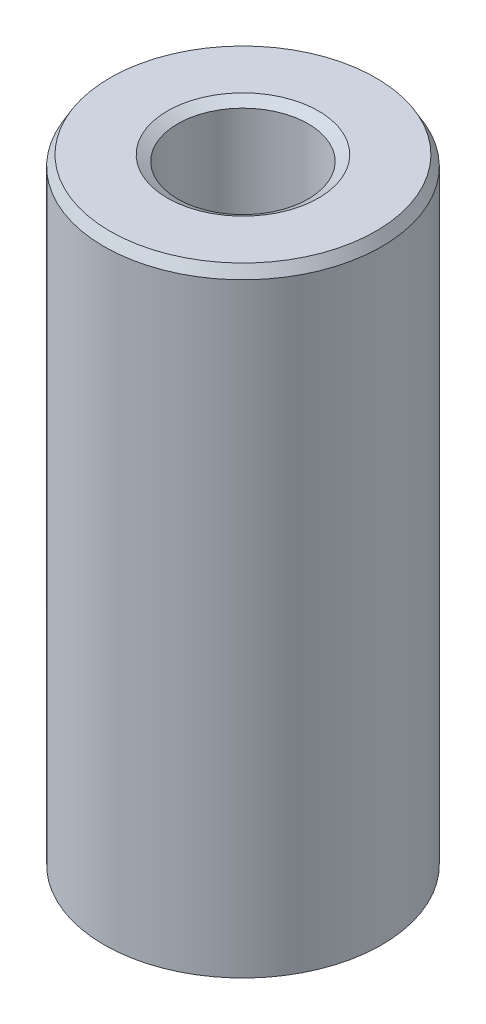
from build123d import *
from OCP.BRepFilletAPI import BRepFilletAPI_MakeChamfer

# Parameters (mm, degrees)
SKETCH1_R           = 22.5
BOSS_EXTRUDE1_DEPTH = 100.612969932
SKETCH2_R           = 10.570219686
CUT_EXTRUDE1_DEPTH  = 106.524735103
CHAMFER1_SIZE       = 1.670223606
CHAMFER1_SIZE2      = 0.964304048


with BuildPart() as part:
    # Sketch1 → Boss-Extrude1 (new body)
    with BuildSketch(Plane(origin=(0, 0, 0), x_dir=(1, 0, 0), z_dir=(0, 1, 0))):
        Circle(SKETCH1_R)
    extrude(amount=BOSS_EXTRUDE1_DEPTH)

    # Sketch2 → Cut-Extrude1 (cut, through all)
    with BuildSketch(Plane(origin=(0, 0, 0), x_dir=(1, 0, 0), z_dir=(0, 1, 0))):
        Circle(SKETCH2_R)
    extrude(amount=CUT_EXTRUDE1_DEPTH, mode=Mode.SUBTRACT)

    # Chamfer1: one chamfer whose edges measure the first distance from different faces: ONE call of the kernel's chamfer builder (chamfer() names one face for all edges)
    chamfer1_edges_1 = [part.edges().sort_by_distance(p)[0] for p in [
        (-10.570219686, 100.612969932, 0),
    ]]
    chamfer1_side_1 = [part.faces().sort_by_distance(p)[0] for p in [
        (-21.863603897, 100.612969932, 0),
    ]]
    chamfer1_edges_2 = [part.edges().sort_by_distance(p)[0] for p in [
        (-10.570219686, 0, 0),
    ]]
    chamfer1_side_2 = [part.faces().sort_by_distance(p)[0] for p in [
        (-10.570219686, 50.306484966, 0),
    ]]
    chamfer1_edges_3 = [part.edges().sort_by_distance(p)[0] for p in [
        (-22.5, 0, 0),
    ]]
    chamfer1_side_3 = [part.faces().sort_by_distance(p)[0] for p in [
        (-21.863603897, 0, 0),
    ]]
    chamfer1_edges_4 = [part.edges().sort_by_distance(p)[0] for p in [
        (-22.5, 100.612969932, 0),
    ]]
    chamfer1_side_4 = [part.faces().sort_by_distance(p)[0] for p in [
        (-22.5, 50.306484966, 0),
    ]]
    chamfer1 = BRepFilletAPI_MakeChamfer(part.part.solid().wrapped)
    for e in chamfer1_edges_1:
        chamfer1.Add(CHAMFER1_SIZE, CHAMFER1_SIZE2, e.wrapped, chamfer1_side_1[0].wrapped)  # the first distance lies on this face
    for e in chamfer1_edges_2:
        chamfer1.Add(CHAMFER1_SIZE, CHAMFER1_SIZE2, e.wrapped, chamfer1_side_2[0].wrapped)  # the first distance lies on this face
    for e in chamfer1_edges_3:
        chamfer1.Add(CHAMFER1_SIZE, CHAMFER1_SIZE2, e.wrapped, chamfer1_side_3[0].wrapped)  # the first distance lies on this face
    for e in chamfer1_edges_4:
        chamfer1.Add(CHAMFER1_SIZE, CHAMFER1_SIZE2, e.wrapped, chamfer1_side_4[0].wrapped)  # the first distance lies on this face
    add(Compound.cast(chamfer1.Shape()), mode=Mode.REPLACE)


solid = part.part
